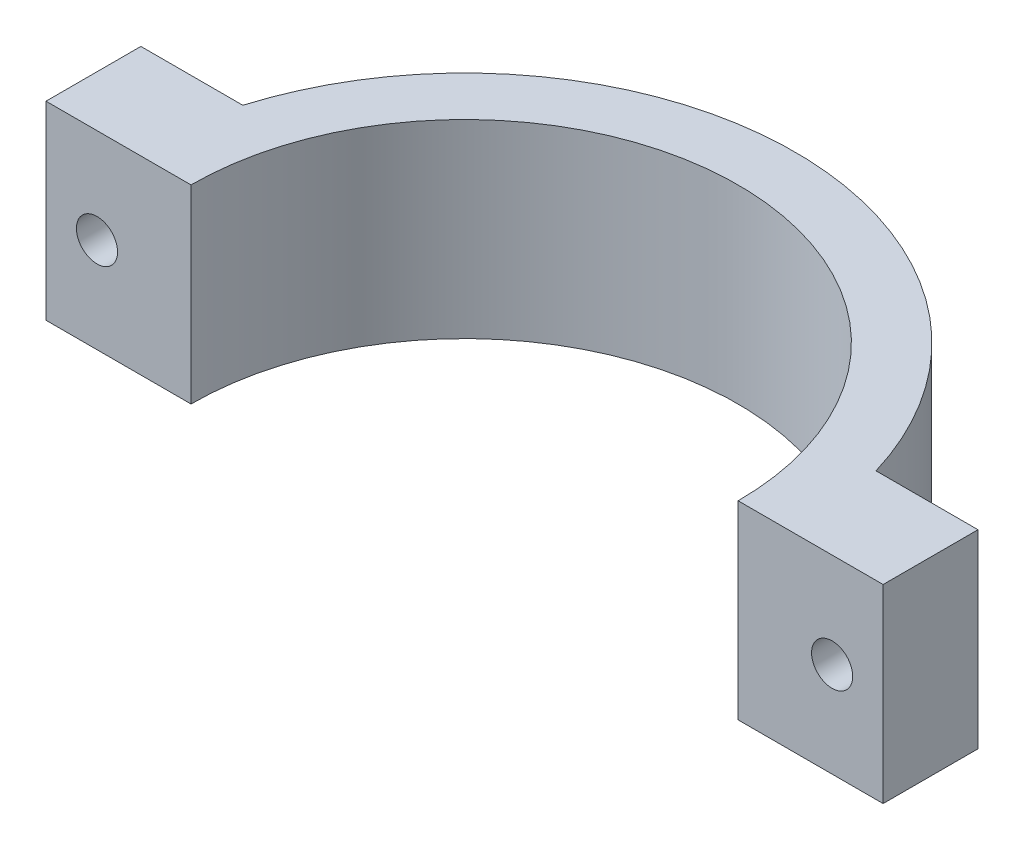
from build123d import *

# Parameters (mm, degrees)
BOSS_EXTRUDE1_DEPTH = 15
SKETCH2_R           = 3.25
CUT_EXTRUDE1_DEPTH  = 78.406027705


with BuildPart() as part:
    # Sketch1 → Boss-Extrude1 (new, symmetric)
    with BuildSketch(Plane(origin=(0, 0, 0), x_dir=(1, 0, 0), z_dir=(0, 1, 0))):
        with BuildLine():
            Line((-66.175, 0), (-66.175, 15))
            Line((-66.175, 15), (-50.050599397, 15))
            ThreePointArc((-50.050599397, 15), (0, 52.25), (50.050599397, 15))
            Line((50.050599397, 15), (66.175, 15))
            Line((66.175, 15), (66.175, 0))
            Line((66.175, 0), (43.25, 0))
            ThreePointArc((43.25, 0), (0, 43.25), (-43.25, 0))
            Line((-43.25, 0), (-66.175, 0))
        make_face()
    extrude(amount=BOSS_EXTRUDE1_DEPTH, both=True)

    # Sketch2 → Cut-Extrude1 (cut, through all)
    with BuildSketch(Plane(origin=(0, 0, -15), x_dir=(-1, 0, 0), z_dir=(0, 0, -1))):
        with Locations((58.112799699, 0)):
            Circle(SKETCH2_R)
        with Locations((-58.112799699, 0)):
            Circle(SKETCH2_R)
    extrude(amount=-CUT_EXTRUDE1_DEPTH, mode=Mode.SUBTRACT)


solid = part.part
